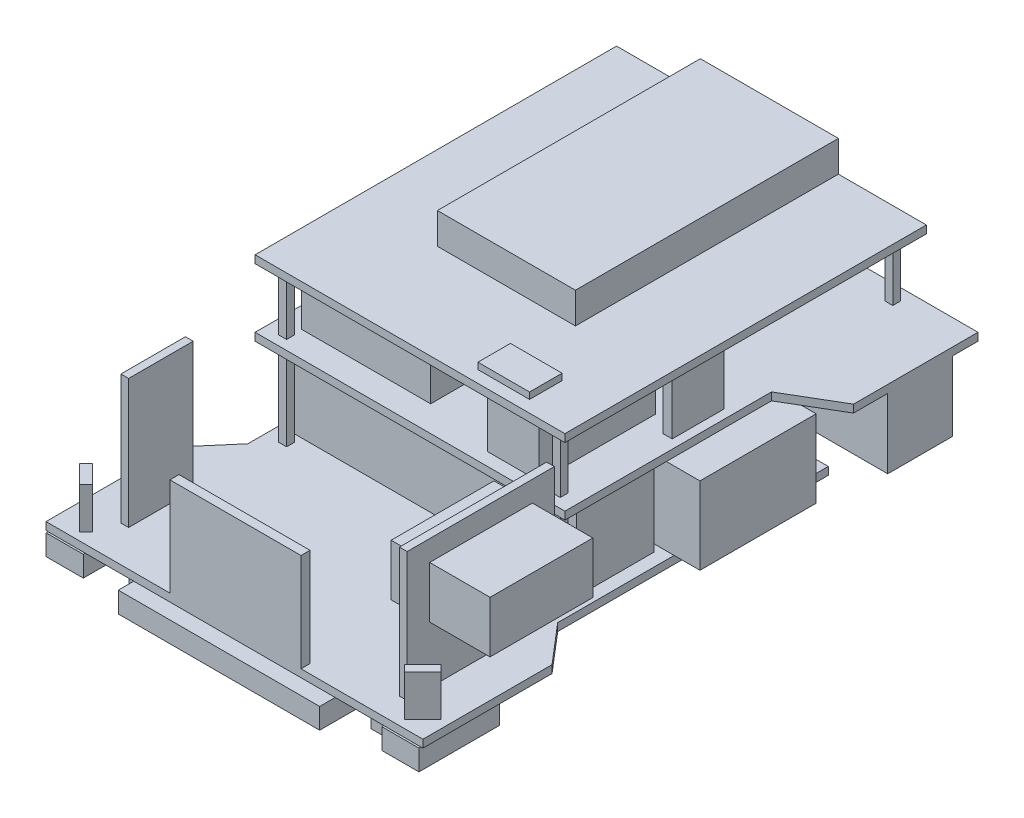
from build123d import *

# Parameters (mm, degrees)
BOSS_EXTRUDE1_DEPTH       = 3
SKETCH2_W                 = 3.05
SKETCH2_H                 = 3.05
BOSS_EXTRUDE2_DEPTH       = 33
BOSS_EXTRUDE3_DEPTH       = 3
SKETCH4_W                 = 3.05
SKETCH4_H                 = 3.05
BOSS_EXTRUDE4_DEPTH       = 23
SKETCH6_W                 = 120
SKETCH6_H                 = 140
BOSS_EXTRUDE5_DEPTH       = 3
SKETCH7_W                 = 68
SKETCH7_H                 = 25
BOSS_EXTRUDE6_DEPTH       = 27
SKETCH9_W                 = 58
SKETCH9_H                 = 60
SKETCH9_W_2               = 20
SKETCH9_H_2               = 45
SKETCH9_W_3               = 50
SKETCH9_H_3               = 30
BOSS_EXTRUDE7_DEPTH       = 20
SKETCH10_W                = 53.46
SKETCH10_H                = 101.85
BOSS_EXTRUDE8_DEPTH       = 12
SKETCH11_W                = 110
SKETCH11_H                = 30
BOSS_EXTRUDE9_DEPTH       = 32
SKETCH12_W                = 140
SKETCH12_H                = 45
BOSS_EXTRUDE10_DEPTH      = 30
SKETCH13_W                = 20
SKETCH13_H                = 12.6
BOSS_EXTRUDE11_DEPTH      = 2.5
SKETCH14_W                = 3.6
SKETCH14_H                = 20
BOSS_EXTRUDE12_DEPTH      = 20
BOSS_EXTRUDE13_DEPTH      = 16
SKETCH16_W                = 3
SKETCH16_H                = 57
SKETCH16_H_2              = 25
BOSS_EXTRUDE14_DEPTH      = 50
BOSS_EXTRUDE15_DEPTH      = 23.4
BOSS_EXTRUDE15_DEPTH_BACK = 14.9
SKETCH17_W                = 39.808487161
SKETCH17_H                = 20
SKETCH18_W                = 78
SKETCH18_H                = 25
SKETCH18_W_2              = 14.4
SKETCH18_H_2              = 31.3
BOSS_EXTRUDE16_DEPTH      = 8
SKETCH20_W                = 10
SKETCH20_H                = 10
BOSS_EXTRUDE18_DEPTH      = 14.56
SKETCH21_W                = 8
SKETCH21_H                = 8
CUT_EXTRUDE1_DEPTH        = 5
SKETCH22_W                = 50.76
SKETCH22_H                = 3.5
BOSS_EXTRUDE19_DEPTH      = 38


with BuildPart() as part:
    # Sketch1 → Boss-Extrude1 (new body)
    with BuildSketch(Plane(origin=(0, 0, 0), x_dir=(1, 0, 0), z_dir=(0, 1, 0))):
        Polygon((-73, -35), (-60, -19.801315846), (-60, 85), (60, 85), (60, -19.801315846), (73, -35), (73, -85), (60, -85), (-60, -85), (-73, -85), align=None)
    extrude(amount=BOSS_EXTRUDE1_DEPTH)

    # Sketch2 → Boss-Extrude2 (add)
    with BuildSketch(Plane(origin=(0, 3, 0), x_dir=(1, 0, 0), z_dir=(0, 1, 0))):
        with Locations((-53, -11.81)):
            Rectangle(SKETCH2_W, SKETCH2_H)
        with Locations((53, -11.81)):
            Rectangle(SKETCH2_W, SKETCH2_H)
        with Locations((54, 75)):
            Rectangle(SKETCH2_W, SKETCH2_H)
        with Locations((-54, 75)):
            Rectangle(SKETCH2_W, SKETCH2_H)
    extrude(amount=BOSS_EXTRUDE2_DEPTH)

    # Sketch3 → Boss-Extrude3 (add)
    with BuildSketch(Plane(origin=(0, 36, 0), x_dir=(1, 0, 0), z_dir=(0, 1, 0))):
        Polygon((-60, 62.99), (-60, -17.01), (60, -17.01), (60, 62.99), (80, 74.780305915), (80, 122.99), (-80, 122.99), (-80, 74.780305915), align=None)
    extrude(amount=BOSS_EXTRUDE3_DEPTH)

    # Sketch4 → Boss-Extrude4 (add)
    with BuildSketch(Plane(origin=(0, 39, 0), x_dir=(1, 0, 0), z_dir=(0, 1, 0))):
        with Locations((-53, -11.81)):
            Rectangle(SKETCH4_W, SKETCH4_H)
        with Locations((-53, 116.99)):
            Rectangle(SKETCH4_W, SKETCH4_H)
        with Locations((53, -11.81)):
            Rectangle(SKETCH4_W, SKETCH4_H)
        with Locations((53, 116.99)):
            Rectangle(SKETCH4_W, SKETCH4_H)
    extrude(amount=BOSS_EXTRUDE4_DEPTH)

    # Sketch6 → Boss-Extrude5 (add)
    with BuildSketch(Plane(origin=(0, 62, 0), x_dir=(1, 0, 0), z_dir=(0, 1, 0))):
        with Locations((0, 52.99)):
            Rectangle(SKETCH6_W, SKETCH6_H)
    extrude(amount=BOSS_EXTRUDE5_DEPTH)

    # Sketch7 → Boss-Extrude6 (add)
    with BuildSketch(Plane.XZ.offset(-36)):
        with Locations((-46, -100.53)):
            Rectangle(SKETCH7_W, SKETCH7_H)
        with Locations((46, -100.53)):
            Rectangle(SKETCH7_W, SKETCH7_H)
    extrude(amount=BOSS_EXTRUDE6_DEPTH)

    # Sketch9 → Boss-Extrude7 (add)
    with BuildSketch(Plane(origin=(0, 39, 0), x_dir=(1, 0, 0), z_dir=(0, 1, 0))):
        with Locations((-1.05, 85.88)):
            Rectangle(SKETCH9_W, SKETCH9_H)
        with Locations((35, 10.49)):
            Rectangle(SKETCH9_W_2, SKETCH9_H_2)
        with Locations((-27, 7.99)):
            Rectangle(SKETCH9_W_3, SKETCH9_H_3)
    extrude(amount=BOSS_EXTRUDE7_DEPTH)

    # Sketch10 → Boss-Extrude8 (add)
    with BuildSketch(Plane(origin=(0, 65, 0), x_dir=(1, 0, 0), z_dir=(0, 1, 0))):
        with Locations((-0.81, 72.065)):
            Rectangle(SKETCH10_W, SKETCH10_H)
    extrude(amount=BOSS_EXTRUDE8_DEPTH)

    # Sketch11 → Boss-Extrude9 (add)
    with BuildSketch(Plane(origin=(0, 3, 0), x_dir=(1, 0, 0), z_dir=(0, 1, 0))):
        with Locations((0, 7.543684861)):
            Rectangle(SKETCH11_W, SKETCH11_H)
    extrude(amount=BOSS_EXTRUDE9_DEPTH)

    # Sketch12 → Boss-Extrude10 (add)
    with BuildSketch(Plane(origin=(0, 3, 0), x_dir=(1, 0, 0), z_dir=(0, 1, 0))):
        with Locations((0, 47.793183731)):
            Rectangle(SKETCH12_W, SKETCH12_H)
    extrude(amount=BOSS_EXTRUDE10_DEPTH)

    # Sketch13 → Boss-Extrude11 (add)
    with BuildSketch(Plane(origin=(0, 65, 0), x_dir=(1, 0, 0), z_dir=(0, 1, 0))):
        with Locations((31.68, -6.09)):
            Rectangle(SKETCH13_W, SKETCH13_H)
    extrude(amount=BOSS_EXTRUDE11_DEPTH)

    # Sketch14 → Boss-Extrude12 (add)
    with BuildSketch(Plane(origin=(0, 39, 0), x_dir=(1, 0, 0), z_dir=(0, 1, 0))):
        with Locations((54.75, 37.99)):
            Rectangle(SKETCH14_W, SKETCH14_H)
        with Locations((-54.75, 37.99)):
            Rectangle(SKETCH14_W, SKETCH14_H)
    extrude(amount=BOSS_EXTRUDE12_DEPTH)

    # Sketch15 → Boss-Extrude13 (add)
    with BuildSketch(Plane(origin=(0, 3, 0), x_dir=(1, 0, 0), z_dir=(0, 1, 0))):
        Polygon((62.928932188, -82), (60.454058454, -79.525126266), (67.525126266, -72.454058454), (70, -74.928932188), align=None)
        Polygon((-70, -74.928932188), (-62.928932188, -82), (-60.454058454, -79.525126266), (-67.525126266, -72.454058454), align=None)
    extrude(amount=BOSS_EXTRUDE13_DEPTH)

    # Sketch16 → Boss-Extrude14 (add)
    with BuildSketch(Plane(origin=(0, 3, 0), x_dir=(1, 0, 0), z_dir=(0, 1, 0))):
        with Locations((55.5, -46.6)):
            Rectangle(SKETCH16_W, SKETCH16_H)
        with Locations((-56.5, -58.5)):
            Rectangle(SKETCH16_W, SKETCH16_H_2)
    extrude(amount=BOSS_EXTRUDE14_DEPTH)

    # Sketch17 → Boss-Extrude15 (add, two sides: drawn at the far end of the back side and taken through both)
    with BuildSketch(Plane(origin=(57, 0, 0), x_dir=(0, 0, -1), z_dir=(1, 0, 0)).offset(-BOSS_EXTRUDE15_DEPTH_BACK)):
        with Locations((-46.50705122, 35)):
            Rectangle(SKETCH17_W, SKETCH17_H)
    extrude(amount=BOSS_EXTRUDE15_DEPTH + BOSS_EXTRUDE15_DEPTH_BACK)

    # Sketch18 → Boss-Extrude16 (add)
    with BuildSketch(Plane.XZ):
        with Locations((0, 78.5)):
            Rectangle(SKETCH18_W, SKETCH18_H)
        with Locations((-65, 70.1)):
            Rectangle(SKETCH18_W_2, SKETCH18_H_2)
        with Locations((65, 70.1)):
            Rectangle(SKETCH18_W_2, SKETCH18_H_2)
    extrude(amount=BOSS_EXTRUDE16_DEPTH)

    # Sketch20 → Boss-Extrude18 (add)
    with BuildSketch(Plane.XZ):
        with Locations((-46.89, 69)):
            Rectangle(SKETCH20_W, SKETCH20_H)
        with Locations((46.89, 69)):
            Rectangle(SKETCH20_W, SKETCH20_H)
    extrude(amount=BOSS_EXTRUDE18_DEPTH)

    # Sketch21 → Cut-Extrude1 (cut)
    with BuildSketch(Plane.XZ.offset(14.56)):
        with Locations((46.89, 69)):
            Rectangle(SKETCH21_W, SKETCH21_H)
        with Locations((-46.89, 69)):
            Rectangle(SKETCH21_W, SKETCH21_H)
    extrude(amount=-CUT_EXTRUDE1_DEPTH, mode=Mode.SUBTRACT)

    # Sketch22 → Boss-Extrude19 (add)
    with BuildSketch(Plane(origin=(0, 3, 0), x_dir=(1, 0, 0), z_dir=(0, 1, 0))):
        with Locations((0.38, -83.25)):
            Rectangle(SKETCH22_W, SKETCH22_H)
    extrude(amount=BOSS_EXTRUDE19_DEPTH)


solid = part.part
